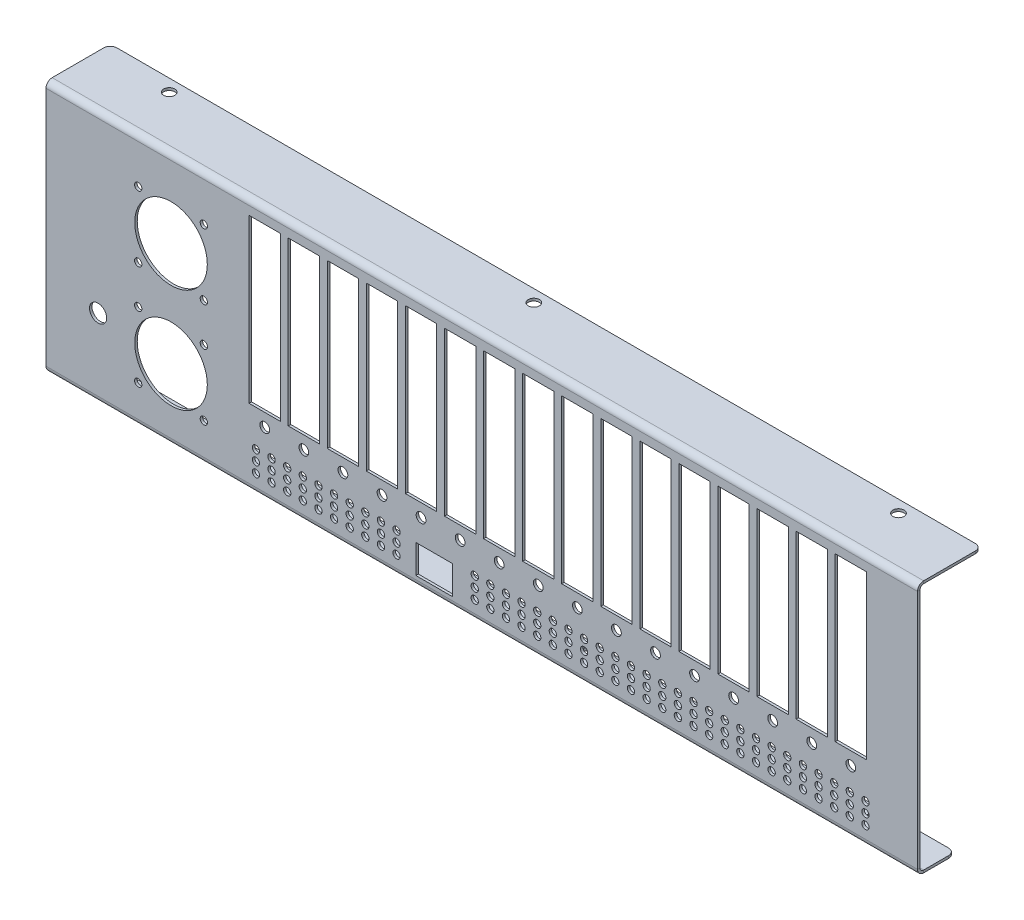
from build123d import *

# Parameters (mm, degrees)
SKETCH1_W                                  = 424.942
SKETCH1_H                                  = 123.3424
BASE_FLANGE_DEPTH                          = 1.2192
EDGE_FLANGE1_STRIP_W                       = 8.4328
EDGE_FLANGE1_STRIP_H                       = 1.2192
EDGE_FLANGE1_STRIP_CUT_DEPTH               = 424.942
EDGE_FLANGE1_DEPTH                         = 424.942
EDGE_FLANGE2_STRIP_W                       = 8.4328
EDGE_FLANGE2_STRIP_H                       = 1.2192
EDGE_FLANGE2_STRIP_CUT_DEPTH               = 424.942
EDGE_FLANGE2_DEPTH                         = 424.942
SKETCH13_R                                 = 2.4765
F_8_32_CLEARANCE_FOR_CHASSI_STUDS_DEPTH    = 1.2192
SKETCH14_R                                 = 2.7051
F_8_32_PEM_NUTS_FOR_COVER_ATTACHMENT_DEPTH = 1.2192
FILLET1_R                                  = 3.175
SKETCH16_R                                 = 2.38125
SKETCH16_W                                 = 15.24
SKETCH16_H                                 = 79.375
CUT_EXTRUDE5_DEPTH                         = 12.54
LPATTERN1_COUNT                            = 16
LPATTERN1_PITCH                            = 19.05
SKETCH17_W                                 = 17.78
SKETCH17_H                                 = 13.97
NIC_PORT_DEPTH                             = 2.54
AIR_HOLES_R                                = 1.778
CUT_EXTRUDE7_DEPTH                         = 2.54
AIR_HOLE_PATTERN_COUNT                     = 3
AIR_HOLE_PATTERN_PITCH                     = 5.08
AIR_HOLE_PATTERN_COUNT_DIR2                = 40
AIR_HOLE_PATTERN_PITCH_DIR2                = 7.62
FAN_MOUNT_HOLES_R                          = 17.694086324
FAN_MOUNT_HOLES_R_2                        = 1.778
CUT_EXTRUDE9_DEPTH                         = 2.54
LPATTERN2_COUNT                            = 2
LPATTERN2_PITCH                            = 50.8
SKETCH18_R                                 = 4.191
HOLE_FOR_POWER_JACK_DEPTH                  = 2.54


# Sheet-metal steps are written as plain solids
with BuildPart() as part:
    # Sketch1 → Base-Flange (new body)
    with BuildSketch(Plane.XY):
        with Locations((212.471, 61.6712)):
            Rectangle(SKETCH1_W, SKETCH1_H)
    extrude(amount=BASE_FLANGE_DEPTH)

    # Edge-Flange1 strip (across the edge) → Edge-Flange1 strip cut (cut)
    with BuildSketch(Plane(origin=(0, 123.3424, 0), x_dir=(0, -1, 0), z_dir=(1, 0, 0))):
        with Locations((-1.2192, -0.6096)):
            Rectangle(EDGE_FLANGE1_STRIP_W, EDGE_FLANGE1_STRIP_H)
    extrude(amount=EDGE_FLANGE1_STRIP_CUT_DEPTH, mode=Mode.SUBTRACT)

    # Edge-Flange1 section (across the edge) → Edge-Flange1 (add)
    with BuildSketch(Plane(origin=(0, 123.3424, 0), x_dir=(0, -1, 0), z_dir=(1, 0, 0))):
        with BuildLine():
            Line((0, 1.778), (0, 30.1498))
            Line((0, 30.1498), (1.2192, 30.1498))
            Line((1.2192, 30.1498), (1.2192, 1.778))
            ThreePointArc((1.2192, 1.778), (1.739964143, 0.520764143), (2.9972, 0))
            Line((2.9972, 0), (2.9972, -1.2192))
            ThreePointArc((2.9972, -1.2192), (0.877859555, -0.341340445), (0, 1.778))
        make_face()
    extrude(amount=EDGE_FLANGE1_DEPTH)

    # Edge-Flange2 strip (across the edge) → Edge-Flange2 strip cut (cut)
    with BuildSketch(Plane(origin=(424.942, 0, 0), x_dir=(0, 1, 0), z_dir=(-1, 0, 0))):
        with Locations((-1.2192, -0.6096)):
            Rectangle(EDGE_FLANGE2_STRIP_W, EDGE_FLANGE2_STRIP_H)
    extrude(amount=EDGE_FLANGE2_STRIP_CUT_DEPTH, mode=Mode.SUBTRACT)

    # Edge-Flange2 section (across the edge) → Edge-Flange2 (add)
    with BuildSketch(Plane(origin=(424.942, 0, 0), x_dir=(0, 1, 0), z_dir=(-1, 0, 0))):
        with BuildLine():
            Line((0, 1.778), (0, 17.145))
            Line((0, 17.145), (1.2192, 17.145))
            Line((1.2192, 17.145), (1.2192, 1.778))
            ThreePointArc((1.2192, 1.778), (1.739964143, 0.520764143), (2.9972, 0))
            Line((2.9972, 0), (2.9972, -1.2192))
            ThreePointArc((2.9972, -1.2192), (0.877859555, -0.341340445), (0, 1.778))
        make_face()
    extrude(amount=EDGE_FLANGE2_DEPTH)

    # Sketch13 → 8-32 Clearance For Chassi Studs (cut)
    with BuildSketch(Plane.XZ):
        with Locations(Location((34.671, -11.4808, 0), (0, 0, 270))):
            Circle(SKETCH13_R)
        with Locations(Location((250.571, -11.4808, 0), (0, 0, 270))):
            Circle(SKETCH13_R)
        with Locations(Location((390.271, -11.4808, 0), (0, 0, 270))):
            Circle(SKETCH13_R)
    extrude(amount=-F_8_32_CLEARANCE_FOR_CHASSI_STUDS_DEPTH, mode=Mode.SUBTRACT)

    # Sketch14 → 8-32 PEM Nuts For Cover Attachment (cut)
    with BuildSketch(Plane(origin=(0, 123.3424, 0), x_dir=(-1, 0, 0), z_dir=(0, 1, 0))):
        with Locations(Location((-390.271, -24.1808, 0), (0, 0, 90))):
            Circle(SKETCH14_R)
        with Locations(Location((-212.471, -24.1808, 0), (0, 0, 90))):
            Circle(SKETCH14_R)
        with Locations(Location((-34.671, -24.1808, 0), (0, 0, 90))):
            Circle(SKETCH14_R)
    extrude(amount=-F_8_32_PEM_NUTS_FOR_COVER_ATTACHMENT_DEPTH, mode=Mode.SUBTRACT)

    # Fillet1
    fillet1_edges = [part.edges().sort_by_distance(p)[0] for p in [
        (0, 122.7328, -30.1498),
        (424.942, 122.7328, -30.1498),
        (424.942, 0.6096, -17.145),
        (0, 0.6096, -17.145),
    ]]
    fillet(fillet1_edges, radius=FILLET1_R)

    # Sketch16 → Cut-Extrude5 (cut)
    with BuildSketch(Plane.XY.offset(1.2192)):
        with Locations((392.43, 30.48)):
            Circle(SKETCH16_R)
        with Locations((392.43, 76.5175)):
            Rectangle(SKETCH16_W, SKETCH16_H)
    cut_extrude5 = extrude(amount=-CUT_EXTRUDE5_DEPTH, mode=Mode.SUBTRACT)

    # LPattern1: Cut-Extrude5 ×16
    with Locations(*[(-i * LPATTERN1_PITCH, 0, 0) for i in range(1, LPATTERN1_COUNT)]):
        add(cut_extrude5, mode=Mode.SUBTRACT)

    # Sketch17 → NIC port (cut)
    with BuildSketch(Plane.XY.offset(1.2192)):
        with Locations((189.23, 11.7602)):
            Rectangle(SKETCH17_W, SKETCH17_H)
    extrude(amount=-NIC_PORT_DEPTH, mode=Mode.SUBTRACT)

    # air holes → Cut-Extrude7 (cut)
    with BuildSketch(Plane.XY.offset(1.2192)):
        with Locations((399.542, 8.89)):
            Circle(AIR_HOLES_R)
    cut_extrude7 = extrude(amount=-CUT_EXTRUDE7_DEPTH, mode=Mode.SUBTRACT)

    # air hole pattern: Cut-Extrude7 3 × 40, 12 skipped
    with Locations(*[(-j * AIR_HOLE_PATTERN_PITCH_DIR2, i * AIR_HOLE_PATTERN_PITCH, 0) for i in range(AIR_HOLE_PATTERN_COUNT) for j in range(AIR_HOLE_PATTERN_COUNT_DIR2) if (i, j) not in ((0, 0), (0, 26), (0, 27), (0, 28), (0, 29), (1, 26), (1, 27), (1, 28), (1, 29), (2, 26), (2, 27), (2, 28), (2, 29))]):
        add(cut_extrude7, mode=Mode.SUBTRACT)

    # fan mount holes → Cut-Extrude9 (cut)
    with BuildSketch(Plane.XY.offset(1.2192)):
        with Locations((60.96, 85.2952)):
            Circle(FAN_MOUNT_HOLES_R)
        with Locations((76.96, 101.2952)):
            Circle(FAN_MOUNT_HOLES_R_2)
        with Locations((76.96, 69.2952)):
            Circle(FAN_MOUNT_HOLES_R_2)
        with Locations((44.96, 69.2952)):
            Circle(FAN_MOUNT_HOLES_R_2)
        with Locations((44.96, 101.2952)):
            Circle(FAN_MOUNT_HOLES_R_2)
    cut_extrude9 = extrude(amount=-CUT_EXTRUDE9_DEPTH, mode=Mode.SUBTRACT)

    # LPattern2: Cut-Extrude9 ×2
    with Locations(*[(0, -i * LPATTERN2_PITCH, 0) for i in range(1, LPATTERN2_COUNT)]):
        add(cut_extrude9, mode=Mode.SUBTRACT)

    # Sketch18 → Hole for Power Jack (cut)
    with BuildSketch(Plane.XY.offset(1.2192)):
        with Locations((25.4, 38.1)):
            Circle(SKETCH18_R)
    extrude(amount=-HOLE_FOR_POWER_JACK_DEPTH, mode=Mode.SUBTRACT)


solid = part.part
